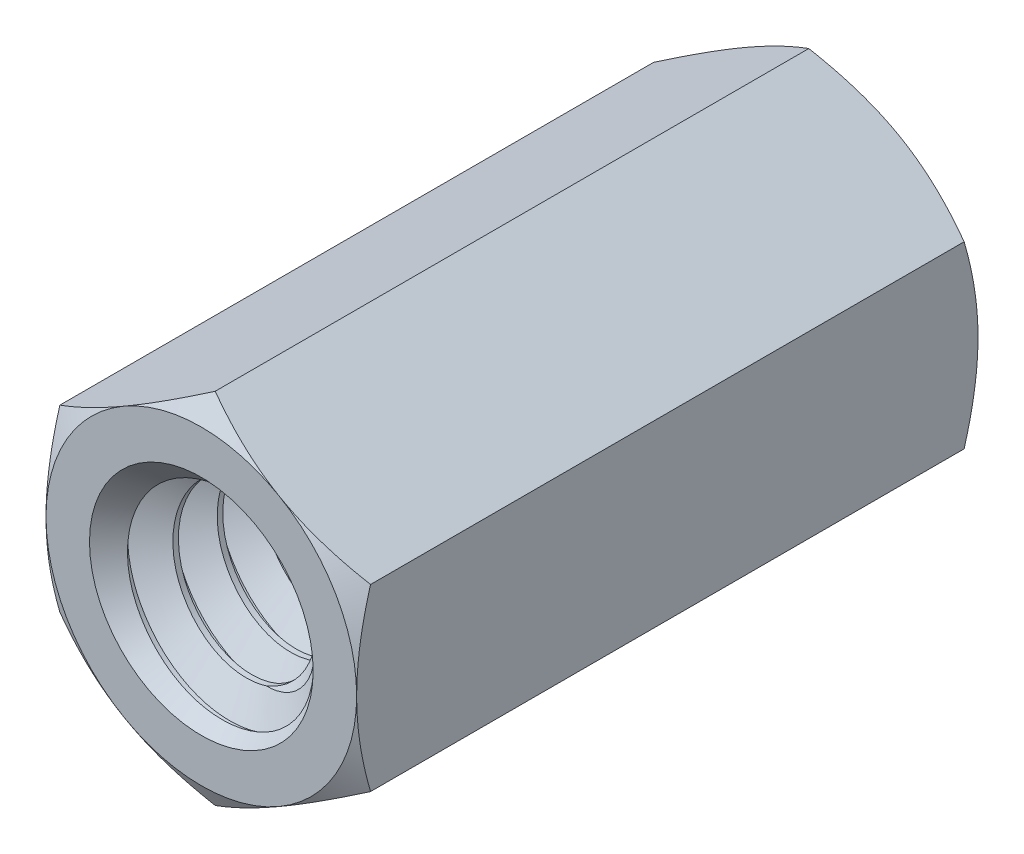
from build123d import *

# Parameters (mm, degrees)
EXTRUDE1_DEPTH          = 3.175
EXTRUDE1_DEPTH_BACK     = 3.175
SKETCH1_R               = 1.0922
SWEEP1_PITCH            = 0.453571429
EXTRUDE2_DEPTH          = 8.222970834
SKETCH8_OUTSIDE_W       = 35.332
SKETCH8_OUTSIDE_H       = 35.822
SKETCH8_OUTSIDE_R       = 1.5875
EXTRUDE4_DEPTH          = 8.222970834
EXTRUDE4_DRAFT          = -60
MIRROR1_COPY_1_SKETCH_W = 35.332
MIRROR1_COPY_1_SKETCH_H = 35.822
MIRROR1_COPY_1_SKETCH_R = 1.5875
MIRROR1_COPY_1_DEPTH    = 8.222970834
MIRROR1_COPY_1_DRAFT    = -60


with BuildPart() as part:
    # Sketch1 → Extrude1 (new, two sides: drawn at the far end of the back side and taken through both)
    with BuildSketch(Plane.XY.offset(-EXTRUDE1_DEPTH_BACK)):
        Polygon((0, 1.833087105), (-1.5875, 0.916543552), (-1.5875, -0.916543552), (0, -1.833087105), (1.5875, -0.916543552), (1.5875, 0.916543552), align=None)
        Circle(SKETCH1_R, mode=Mode.SUBTRACT)
    extrude(amount=EXTRUDE1_DEPTH + EXTRUDE1_DEPTH_BACK)

    # Sweep1: the profile of Sketch12 profile screwed along a right-hand helix of 15 turns, 6 arcs to a turn; built about Z, then put on its axis
    sweep1_z = Axis((0, 0, 0), (0, 0, 1))
    sweep1_corners = [(1.0925, 0, -0.397048205), (1.0925, 0, 0.000173205), (0.797596715, 0, -0.170089286), (0.797596715, 0, -0.226785714)]
    with BuildLine(mode=Mode.PRIVATE) as sweep1_profile:
        Line(sweep1_corners[0], sweep1_corners[1])
        Line(sweep1_corners[1], sweep1_corners[2])
        Line(sweep1_corners[2], sweep1_corners[3])
        Line(sweep1_corners[3], sweep1_corners[0])
    sweep1_cap = Face(sweep1_profile.wire())
    sweep1_turn_angles = [0, 30, 60, 90, 120, 150, 180, 210, 240, 270, 300, 330, 360]
    sweep1_turn_weights = [1, 0.8660254037844387, 1, 0.8660254037844387, 1, 0.8660254037844387, 1, 0.8660254037844387, 1, 0.8660254037844387, 1, 0.8660254037844387, 1]
    sweep1_turn_rails = [Edge.make_bspline([Vector(p[0], p[1], 0).rotate(sweep1_z, sweep1_turn_angles[k]) / sweep1_turn_weights[k] + Vector(0, 0, p[2] + SWEEP1_PITCH * sweep1_turn_angles[k] / 360) for k in range(13)], [0, 0, 0, 1, 1, 2, 2, 3, 3, 4, 4, 5, 5, 6, 6, 6], 2, sweep1_turn_weights) for p in sweep1_corners]
    sweep1_turn_sides = [Face.make_surface_from_curves(sweep1_turn_rails[p[0]], sweep1_turn_rails[p[1]]) for p in [(0, 1), (1, 2), (2, 3), (3, 0)]]
    sweep1 = Plane(origin=(0, 0, -3.175), x_dir=(0, 1, 0), z_dir=(0, 0, 1)) * Solid(Shell([*[p.moved(Location((0, 0, SWEEP1_PITCH * i))) for i in range(15) for p in sweep1_turn_sides], sweep1_cap, sweep1_cap.rotate(sweep1_z, 5400).moved(Location((0, 0, SWEEP1_PITCH * 5400 / 360)))]))
    add(sweep1)

    # Sketch6 → Extrude2 (cut, through all)
    with BuildSketch(Plane(origin=(0, 0, -3.175), x_dir=(-1, 0, 0), z_dir=(0, 0, -1))):
        Polygon((0, 1.833087105), (-1.5875, 0.916543552), (-1.5875, -0.916543552), (0, -1.833087105), (1.5875, -0.916543552), (1.5875, 0.916543552), align=None)
    extrude2 = extrude(amount=EXTRUDE2_DEPTH, mode=Mode.SUBTRACT)

    # Extrude3 cone 1 section (through the dimple's axis) → Extrude3 (revolve, cut)
    with BuildSketch(Plane(origin=(0, 0, -3.175), x_dir=(0, 1, 0), z_dir=(1, 0, 0))):
        Polygon((0, 0), (1.143, 0), (0, 1.225717436), align=None)
    extrude3 = revolve(axis=Axis((0, 0, -3.175), (0, 0, 1)), mode=Mode.SUBTRACT)


with BuildPart() as extrude4_tool:
    # Sketch8 outside → Extrude4 (with draft: the straight prism first)
    with BuildSketch(Plane(origin=(0, 0, -3.175), x_dir=(-1, 0, 0), z_dir=(0, 0, -1))):
        Rectangle(SKETCH8_OUTSIDE_W, SKETCH8_OUTSIDE_H)
        Circle(SKETCH8_OUTSIDE_R, mode=Mode.SUBTRACT)
    extrude(amount=-EXTRUDE4_DEPTH)
    # Extrude4: the draft: its side faces are tilted about the plane it starts from
    extrude4_sides = [extrude4_tool.faces().sort_by_distance(p)[0] for p in [
        (0, -17.911, 0.936485417),
        (-17.666, 0, 0.936485417),
        (0, 17.911, 0.936485417),
        (17.666, 0, 0.936485417),
        (1.5875, 0, 0.936485417),
    ]]
    draft(extrude4_sides, Plane(origin=(0, 0, -3.175), x_dir=(-1, 0, 0), z_dir=(0, 0, -1)), EXTRUDE4_DRAFT)


with BuildPart() as part_1:
    add(part.part)

    # Extrude4: cut by extrude4_tool
    add(extrude4_tool.part, mode=Mode.SUBTRACT)

    # Mirror1: Extrude2, Extrude3 across plane
    add(extrude2.mirror(Plane.XY), mode=Mode.SUBTRACT)
    add(extrude3.mirror(Plane.XY), mode=Mode.SUBTRACT)


with BuildPart() as mirror1_copy_1_tool:
    # Mirror1 copy 1 sketch → Mirror1 copy 1 (with draft: the straight prism first)
    with BuildSketch(Plane(origin=(0, 0, 3.175), x_dir=(-1, 0, 0), z_dir=(0, 0, 1))):
        Rectangle(MIRROR1_COPY_1_SKETCH_W, MIRROR1_COPY_1_SKETCH_H)
        Circle(MIRROR1_COPY_1_SKETCH_R, mode=Mode.SUBTRACT)
    extrude(amount=-MIRROR1_COPY_1_DEPTH)
    # Mirror1 copy 1: the draft: its side faces are tilted about the plane it starts from
    mirror1_copy_1_sides = [mirror1_copy_1_tool.faces().sort_by_distance(p)[0] for p in [
        (0, -17.911, -0.936485417),
        (-17.666, 0, -0.936485417),
        (0, 17.911, -0.936485417),
        (17.666, 0, -0.936485417),
        (1.5875, 0, -0.936485417),
    ]]
    draft(mirror1_copy_1_sides, Plane(origin=(0, 0, 3.175), x_dir=(-1, 0, 0), z_dir=(0, 0, 1)), MIRROR1_COPY_1_DRAFT)


with BuildPart() as part_2:
    add(part_1.part)

    # Mirror1 copy 1: cut by mirror1_copy_1_tool
    add(mirror1_copy_1_tool.part, mode=Mode.SUBTRACT)


solid = part_2.part
